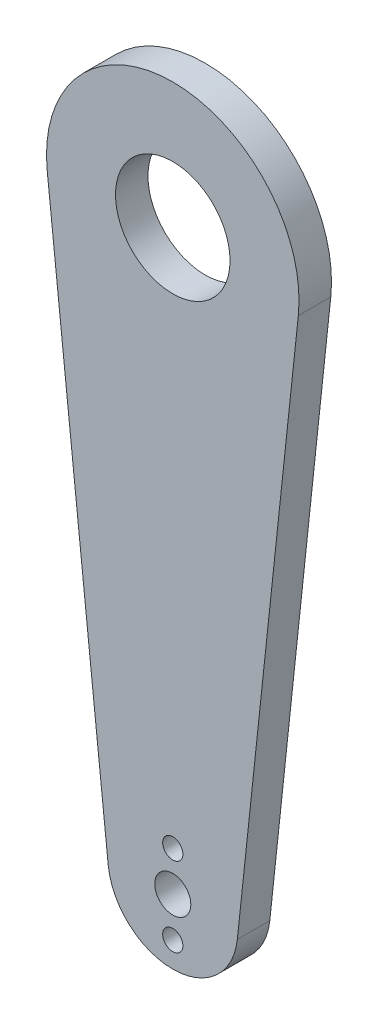
from build123d import *

# Parameters (mm, degrees)
SKETCH1_R           = 7.9375
SKETCH1_R_2         = 2.5
SKETCH1_R_3         = 1.4
BOSS_EXTRUDE1_DEPTH = 4.5


with BuildPart() as part:
    # Sketch1 → Boss-Extrude1 (new body)
    with BuildSketch(Plane.XY):
        with BuildLine():
            Line((-8.94905503, -0.95625), (-17.400940337, 78.140625))
            ThreePointArc((-17.400940337, 78.140625), (0, 97.5), (17.400940337, 78.140625))
            Line((17.400940337, 78.140625), (8.94905503, -0.95625))
            ThreePointArc((8.94905503, -0.95625), (0, -9), (-8.94905503, -0.95625))
        make_face()
        with Locations((0, 80)):
            Circle(SKETCH1_R, mode=Mode.SUBTRACT)
        Circle(SKETCH1_R_2, mode=Mode.SUBTRACT)
        with Locations((0, 5.5)):
            Circle(SKETCH1_R_3, mode=Mode.SUBTRACT)
        with Locations((0, -5.5)):
            Circle(SKETCH1_R_3, mode=Mode.SUBTRACT)
    extrude(amount=BOSS_EXTRUDE1_DEPTH)


solid = part.part
